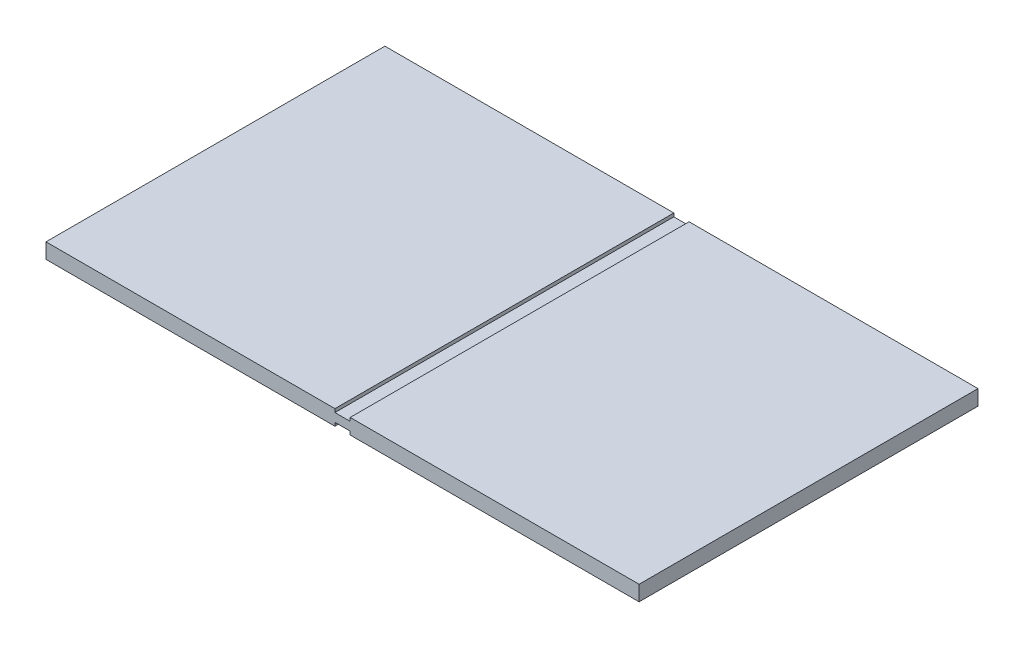
from build123d import *

# Parameters (mm, degrees)
SKETCH1_W           = 700
SKETCH1_H           = 400
BOSS_EXTRUDE1_DEPTH = 18
SKETCH2_W           = 18
SKETCH2_H           = 400
CUT_EXTRUDE1_DEPTH  = 4
SKETCH3_W           = 18
SKETCH3_H           = 400
CUT_EXTRUDE2_DEPTH  = 4


with BuildPart() as part:
    # Sketch1 → Boss-Extrude1 (new body)
    with BuildSketch(Plane(origin=(0, 0, 0), x_dir=(1, 0, 0), z_dir=(0, 1, 0))):
        Rectangle(SKETCH1_W, SKETCH1_H)
    extrude(amount=BOSS_EXTRUDE1_DEPTH)

    # Sketch2 → Cut-Extrude1 (cut)
    with BuildSketch(Plane(origin=(0, 18, 0), x_dir=(1, 0, 0), z_dir=(0, 1, 0))):
        Rectangle(SKETCH2_W, SKETCH2_H)
    extrude(amount=-CUT_EXTRUDE1_DEPTH, mode=Mode.SUBTRACT)

    # Sketch3 → Cut-Extrude2 (cut)
    with BuildSketch(Plane(origin=(0, 0, 0), x_dir=(-1, 0, 0), z_dir=(0, -1, 0))):
        Rectangle(SKETCH3_W, SKETCH3_H)
    extrude(amount=-CUT_EXTRUDE2_DEPTH, mode=Mode.SUBTRACT)


solid = part.part
